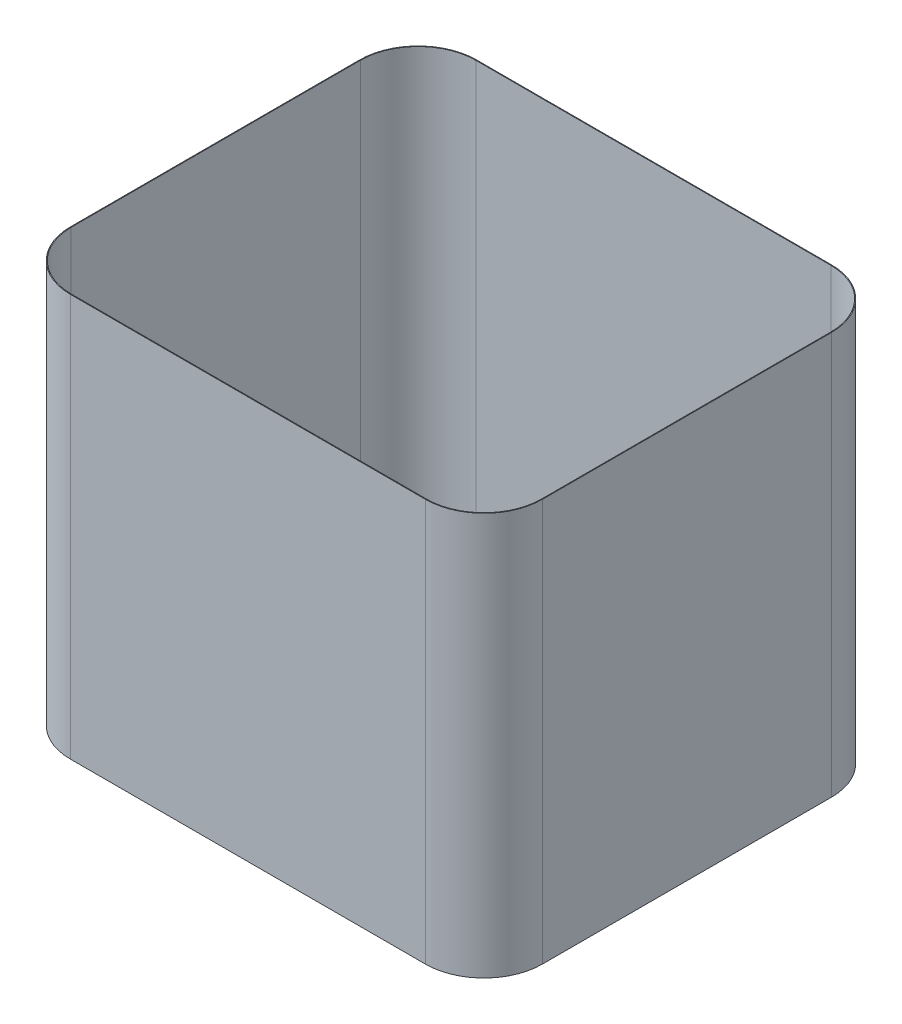
from build123d import *

# Parameters (mm, degrees)
BOSS_EXTRUDE1_DEPTH = 1397
SHELL1_T            = -2.54
CUT_EXTRUDE3_REACH  = 2115.932


with BuildPart() as part:
    # Sketch1 → Boss-Extrude1 (new body)
    with BuildSketch(Plane(origin=(0, 0, 0), x_dir=(1, 0, 0), z_dir=(0, 1, 0))):
        with BuildLine():
            Line((-203.2, -406.4), (1028.7, -406.4))
            ThreePointArc((1028.7, -406.4), (1172.384097937, -346.884097937), (1231.9, -203.2))
            Line((1231.9, -203.2), (1231.9, 800.1))
            ThreePointArc((1231.9, 800.1), (1172.384097937, 943.784097937), (1028.7, 1003.3))
            Line((1028.7, 1003.3), (-203.2, 1003.3))
            ThreePointArc((-203.2, 1003.3), (-346.884097937, 943.784097937), (-406.4, 800.1))
            Line((-406.4, 800.1), (-406.4, -203.2))
            ThreePointArc((-406.4, -203.2), (-346.884097937, -346.884097937), (-203.2, -406.4))
        make_face()
    extrude(amount=BOSS_EXTRUDE1_DEPTH)

    # Shell1
    shell1_openings = [part.faces().sort_by_distance(p)[0] for p in [
        (412.75, 0, -298.45),
    ]]
    offset(amount=SHELL1_T, openings=shell1_openings, kind=Kind.INTERSECTION)

    # Sketch3 → Cut-Extrude3 (cut, up to next)
    with BuildSketch(Plane.XZ.offset(-1394.46), mode=Mode.PRIVATE) as cut_extrude3_sk1:
        with BuildLine():
            Line((-403.86, 203.2), (-403.86, -800.1))
            ThreePointArc((-403.86, -800.1), (-345.088046713, -941.988046713), (-203.2, -1000.76))
            Line((-203.2, -1000.76), (1028.7, -1000.76))
            ThreePointArc((1028.7, -1000.76), (1170.588046713, -941.988046713), (1229.36, -800.1))
            Line((1229.36, -800.1), (1229.36, 203.2))
            ThreePointArc((1229.36, 203.2), (1170.588046713, 345.088046713), (1028.7, 403.86))
            Line((1028.7, 403.86), (-203.2, 403.86))
            ThreePointArc((-203.2, 403.86), (-345.088046713, 345.088046713), (-403.86, 203.2))
        make_face()
    cut_extrude3_tool1 = extrude(cut_extrude3_sk1.sketch, amount=-CUT_EXTRUDE3_REACH, mode=Mode.PRIVATE) & part.part
    add(cut_extrude3_tool1.solids().sort_by_distance((412.75, 1394.46, -298.45))[0], mode=Mode.SUBTRACT)


solid = part.part
